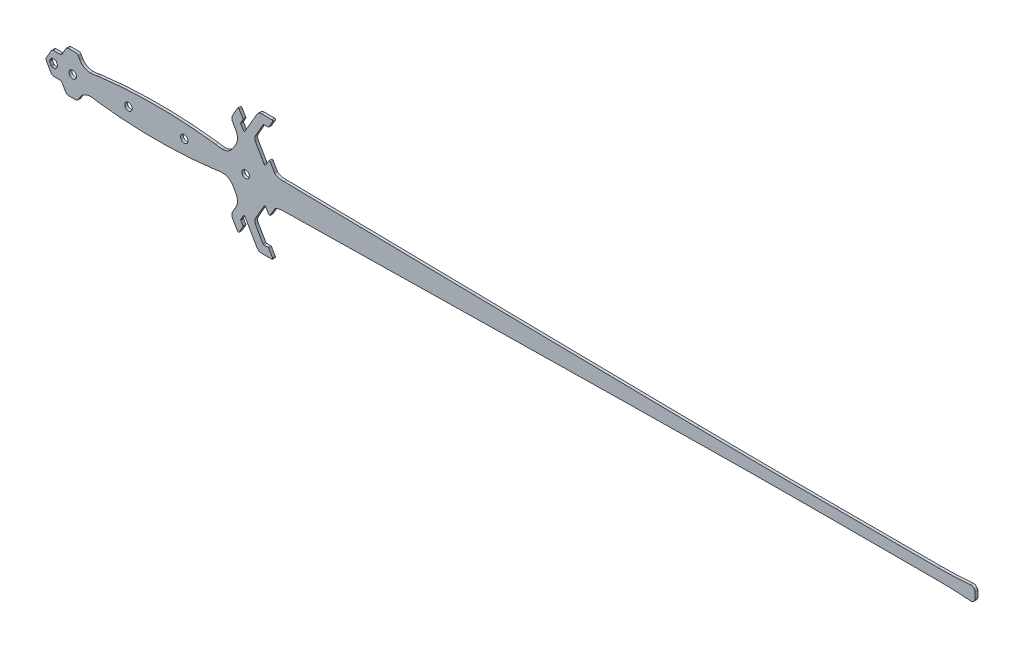
from build123d import *

# Parameters (mm, degrees)
SKETCH_1_R      = 4.025
EXTRUDE_1_DEPTH = 1.5
FILLET_1_R      = 13
FILLET_2_R      = 6
FILLET_3_R      = 1
FILLET_7_R      = 3


with BuildPart() as part:
    # 草图1 → 凸台-拉伸1 (new, symmetric)
    with BuildSketch(Plane.XY):
        with BuildLine():
            Line((38, 14.000000007), (250, 10.55184781))
            ThreePointArc((250, 10.55184781), (369.998701007, 8.688014918), (490.000004009, 7))
            ThreePointArc((490.000004009, 7), (564.99833736, 6.250002778), (640.000004009, 6))
            Line((640.000004009, 6), (750.000004009, 6))
            ThreePointArc((750.000004009, 6), (767.416160301, 6.375174017), (784.800004009, 7.5))
            ThreePointArc((784.800004009, 7.5), (788.089261415, 6.498216371), (789.772556789, 3.5))
            ThreePointArc((789.772556789, 3.5), (790.000004009, 0), (789.772556789, -3.5))
            ThreePointArc((789.772556789, -3.5), (788.089261415, -6.498216371), (784.800004009, -7.5))
            ThreePointArc((784.800004009, -7.5), (767.416160301, -6.375174017), (750.000004009, -6))
            Line((750.000004009, -6), (640.000004009, -6))
            ThreePointArc((640.000004009, -6), (564.99833736, -6.250002778), (490.000004009, -7))
            ThreePointArc((490.000004009, -7), (369.998701007, -8.688014918), (250, -10.55184781))
            Line((250, -10.55184781), (38, -14.000000007))
            Line((38, -14.000000007), (30.845299463, -26.392304848))
            Line((30.845299463, -26.392304848), (26, -18))
            Line((26, -18), (14.154700538, -38.516660498))
            Line((14.154700538, -38.516660498), (24.248711306, -56))
            Line((24.248711306, -56), (29.856406461, -56))
            Line((29.856406461, -56), (35.052558882, -65))
            Line((35.052558882, -65), (19.052558883, -65))
            Line((19.052558883, -65), (3.649147039, -38.320508076))
            Line((3.649147039, -38.320508076), (-0.207259422, -45))
            Line((-0.207259422, -45), (2.596588156, -49.856406461))
            Line((2.596588156, -49.856406461), (-2.599564267, -58.856406461))
            Line((-2.599564267, -58.856406461), (-10.599564267, -45))
            Line((-10.599564267, -45), (-1.547005384, -29.320508076))
            Line((-1.547005384, -29.320508076), (-11.547005384, -12))
            ThreePointArc((-11.547005384, -12), (-19.547005384, -11), (-27.547005384, -12))
            ThreePointArc((-27.547005384, -12), (-90.773502692, -16), (-154, -12))
            ThreePointArc((-154, -12), (-162, -11), (-170, -12))
            Line((-170, -12), (-175.773502692, -22))
            Line((-175.773502692, -22), (-187.226497308, -22))
            Line((-187.226497308, -22), (-193, -12))
            Line((-193, -12), (-203.07179677, -12))
            Line((-203.07179677, -12), (-210, 0))
            Line((-210, 0), (-203.071796768, 12))
            Line((-203.071796768, 12), (-193, 12))
            Line((-193, 12), (-187.226497308, 22))
            Line((-187.226497308, 22), (-175.773502689, 22))
            Line((-175.773502689, 22), (-170, 12))
            ThreePointArc((-170, 12), (-162, 11), (-154, 12))
            ThreePointArc((-154, 12), (-90.773502692, 16), (-27.547005384, 12))
            ThreePointArc((-27.547005384, 12), (-19.547005384, 11), (-11.547005384, 12))
            Line((-11.547005384, 12), (-1.547005384, 29.320508076))
            Line((-1.547005384, 29.320508076), (-10.599564267, 45))
            Line((-10.599564267, 45), (-2.599564267, 58.856406461))
            Line((-2.599564267, 58.856406461), (2.596588156, 49.856406461))
            Line((2.596588156, 49.856406461), (-0.207259422, 45))
            Line((-0.207259422, 45), (3.649147039, 38.320508076))
            Line((3.649147039, 38.320508076), (19.052558883, 65))
            Line((19.052558883, 65), (35.052558883, 65))
            Line((35.052558883, 65), (29.856406461, 56))
            Line((29.856406461, 56), (24.248711306, 56))
            Line((24.248711306, 56), (14.154700538, 38.516660498))
            Line((14.154700538, 38.516660498), (26, 18))
            Line((26, 18), (30.845299464, 26.392304849))
            Line((30.845299464, 26.392304849), (38, 14.000000007))
        make_face()
        with Locations((-120.773502692, 0)):
            Circle(SKETCH_1_R, mode=Mode.SUBTRACT)
        with Locations((-60.773502692, 0)):
            Circle(SKETCH_1_R, mode=Mode.SUBTRACT)
        with Locations((-180.773502692, 0)):
            Circle(SKETCH_1_R, mode=Mode.SUBTRACT)
        with Locations((5.226497308, 0)):
            Circle(SKETCH_1_R, mode=Mode.SUBTRACT)
        Polygon((-206, 0), (-203.690598923, 4), (-199.07179677, 4), (-196.762395693, 0), (-199.07179677, -4), (-203.690598923, -4), align=None, mode=Mode.SUBTRACT)
    extrude(amount=EXTRUDE_1_DEPTH, both=True)

    # 圆角1
    fillet_1_edges = [part.edges().sort_by_distance(p)[0] for p in [
        (-1.547005384, -29.320508076, 0),
        (-11.547005384, -12, 0),
        (-170, -12, 0),
        (-170, 12, 0),
        (-11.547005384, 12, 0),
        (-1.547005384, 29.320508076, 0),
    ]]
    fillet(fillet_1_edges, radius=FILLET_1_R)

    # 圆角2
    fillet_2_edges = [part.edges().sort_by_distance(p)[0] for p in [
        (14.154700538, -38.516660498, 0),
        (19.052558883, -65, 0),
        (-10.599564267, -45, 0),
        (-10.599564267, 45, 0),
        (19.052558883, 65, 0),
        (14.154700538, 38.516660498, 0),
    ]]
    fillet(fillet_2_edges, radius=FILLET_2_R)

    # 圆角3
    fillet_3_edges = [part.edges().sort_by_distance(p)[0] for p in [
        (-196.762395693, 0, 0),
        (-199.07179677, 4, 0),
        (-203.690598923, 4, 0),
        (-206, 0, 0),
        (-203.690598923, -4, 0),
        (-199.07179677, -4, 0),
        (24.248711306, -56, 0),
        (29.856406461, -56, 0),
        (35.052558882, -65, 0),
        (3.649147039, -38.320508076, 0),
        (-0.207259422, -45, 0),
        (2.596588156, -49.856406461, 0),
        (-2.599564267, -58.856406461, 0),
        (-2.599564267, 58.856406461, 0),
        (2.596588156, 49.856406461, 0),
        (-0.207259422, 45, 0),
        (3.649147039, 38.320508076, 0),
        (35.052558883, 65, 0),
        (29.856406461, 56, 0),
        (24.248711306, 56, 0),
        (26, 18, 0),
        (30.845299464, 26.392304849, 0),
        (30.845299463, -26.392304848, 0),
        (26, -18, 0),
    ]]
    fillet(fillet_3_edges, radius=FILLET_3_R)

    # 圆角5
    # a fillet whose section is not a circle: 12, 9 mm, written as the material it adds along each edge
    with BuildSketch(Plane(origin=(38, -14.000000007, 1.5), x_dir=(0.9998677532589965, 0.016262717878828103, 0), z_dir=(0, 0, -1))) as fillet_5_piece_1:
        with BuildLine():
            Bezier((8.596427908, 0), (0, 0), (-1.696926281, 2.831786358), weights=[1, 1, 1])
            Line((-1.696926281, 2.831786358), (0, 0))
            Line((0, 0), (8.596427908, 0))
        make_face()
    extrude(amount=3)

    # 圆角6
    # a fillet whose section is not a circle: 12, 9 mm, written as the material it adds along each edge
    with BuildSketch(Plane(origin=(38, 14.000000007, 1.5), x_dir=(-0.5000000000000278, 0.8660254037844227, 0), z_dir=(0, 0, -1))) as fillet_6_piece_1:
        with BuildLine():
            Bezier((3.301298651, 0), (0, 0), (-4.418716991, 7.373839769), weights=[1, 1, 1])
            Line((-4.418716991, 7.373839769), (0, 0))
            Line((0, 0), (3.301298651, 0))
        make_face()
    extrude(amount=3)

    # 圆角7
    fillet_7_edges = [part.edges().sort_by_distance(p)[0] for p in [
        (-175.773502692, -22, 0),
        (-187.226497308, -22, 0),
        (-193, -12, 0),
        (-203.07179677, -12, 0),
        (-210, 0, 0),
        (-203.071796768, 12, 0),
        (-193, 12, 0),
        (-187.226497308, 22, 0),
        (-175.773502689, 22, 0),
    ]]
    fillet(fillet_7_edges, radius=FILLET_7_R)


solid = part.part
